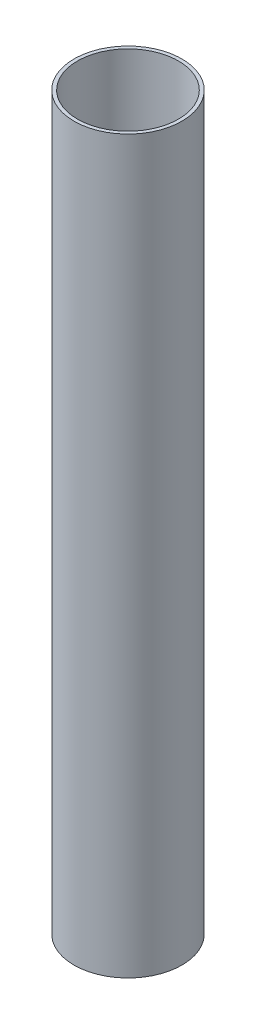
from build123d import *

# Parameters (mm, degrees)
SKETCH1_R           = 15.5
SKETCH1_R_2         = 14.5
BOSS_EXTRUDE1_DEPTH = 210


with BuildPart() as part:
    # Sketch1 → Boss-Extrude1 (new body)
    with BuildSketch(Plane(origin=(0, 0, 0), x_dir=(1, 0, 0), z_dir=(0, 1, 0))):
        Circle(SKETCH1_R)
        Circle(SKETCH1_R_2, mode=Mode.SUBTRACT)
    extrude(amount=BOSS_EXTRUDE1_DEPTH)


solid = part.part
